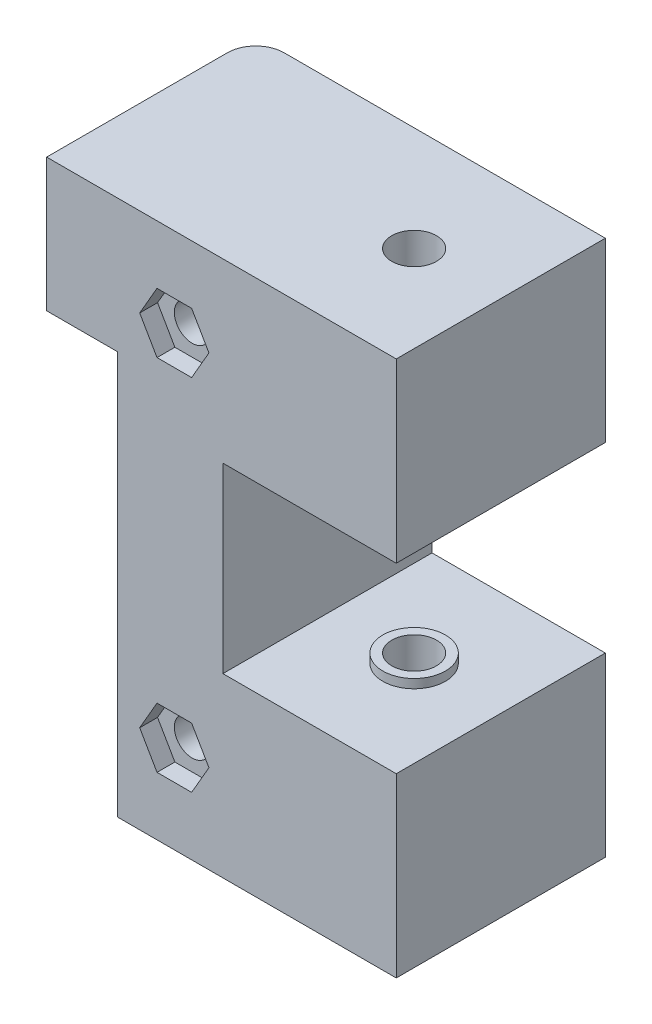
from build123d import *

# Parameters (mm, degrees)
MAINBLOCK_R                     = 2
MAINBLOCKBOSS_EXTRUDE1_DEPTH    = 23.4
TOPHOLECUT_SKETCH2_R            = 2.5
TOPHOLECUT_EXTRUDE1_DEPTH       = 45
MOUNTHOLEBORECUT_EXTRUDE2_DEPTH = 2
TOPSPACERSKETCH4_R              = 3.5
TOPSPACERSKETCH4_R_2            = 2.5
TOPSPACERBOSS_EXTRUDE2_DEPTH    = 1
LOWERSPACERBOSS_EXTRUDE3_START  = 1
LOWERSPACERSKETCH5_R            = 3.5
LOWERSPACERSKETCH5_R_2          = 2.5
LOWERSPACERBOSS_EXTRUDE3_DEPTH  = 1
PUSHPINHOLESKETCH1_R            = 1
PUSHPINHOLECUT_EXTRUDE1_DEPTH   = 76.354665582
MIDRAILINDENTSKETCH1_W          = 7.9375
MIDRAILINDENTSKETCH1_H          = 45.1
MIDRAILINDENTCUT_EXTRUDE1_DEPTH = 76.354665582
VERTICALSUPPORTFILLET1_R        = 3.175


with BuildPart() as part:
    # MainBlock → MainBlockBoss-Extrude1 (new body)
    with BuildSketch(Plane.XY):
        Polygon((0, 0), (39.125, 0), (39.125, 19.8), (19.725, 19.8), (19.725, 40.2), (39.125, 40.2), (39.125, 60), (0, 60), align=None)
        with Locations((14.2875, 50.1)):
            Circle(MAINBLOCK_R, mode=Mode.SUBTRACT)
        with Locations((14.2875, 9.9)):
            Circle(MAINBLOCK_R, mode=Mode.SUBTRACT)
    extrude(amount=MAINBLOCKBOSS_EXTRUDE1_DEPTH)

    # TopHoleCut-Sketch2 → TopHoleCut-Extrude1 (cut)
    with BuildSketch(Plane(origin=(0, 60, 0), x_dir=(1, 0, 0), z_dir=(0, 1, 0))):
        with Locations((29.425, -11.7)):
            Circle(TOPHOLECUT_SKETCH2_R)
    extrude(amount=-TOPHOLECUT_EXTRUDE1_DEPTH, mode=Mode.SUBTRACT)

    # MountHoleBoreSketch3 → MountHoleBoreCut-Extrude2 (cut)
    with BuildSketch(Plane.XY.offset(23.4)):
        Polygon((18.1625, 50.1), (16.225, 53.45584844), (12.35, 53.45584844), (10.4125, 50.1), (12.35, 46.74415156), (16.225, 46.74415156), align=None)
        Polygon((18.1625, 9.9), (16.225, 13.25584844), (12.35, 13.25584844), (10.4125, 9.9), (12.35, 6.54415156), (16.225, 6.54415156), align=None)
    extrude(amount=-MOUNTHOLEBORECUT_EXTRUDE2_DEPTH, mode=Mode.SUBTRACT)

    # TopSpacerSketch4 → TopSpacerBoss-Extrude2 (add)
    with BuildSketch(Plane.XZ.offset(-40.2)):
        with Locations((29.425, 11.7)):
            Circle(TOPSPACERSKETCH4_R)
        with Locations((29.425, 11.7)):
            Circle(TOPSPACERSKETCH4_R_2, mode=Mode.SUBTRACT)
    extrude(amount=TOPSPACERBOSS_EXTRUDE2_DEPTH)

    # LowerSpacerSketch5 → LowerSpacerBoss-Extrude3 (add)
    with BuildSketch(Plane(origin=(0, 19.8, 0), x_dir=(1, 0, 0), z_dir=(0, 1, 0)).offset(LOWERSPACERBOSS_EXTRUDE3_START)):
        with Locations((29.425, -11.7)):
            Circle(LOWERSPACERSKETCH5_R)
        with Locations((29.425, -11.7)):
            Circle(LOWERSPACERSKETCH5_R_2, mode=Mode.SUBTRACT)
    extrude(amount=-LOWERSPACERBOSS_EXTRUDE3_DEPTH)

    # PushPinHoleSketch1 → PushPinHoleCut-Extrude1 (cut, through all)
    with BuildSketch(Plane.XZ):
        with Locations((29.425, 11.7)):
            Circle(PUSHPINHOLESKETCH1_R)
    extrude(amount=-PUSHPINHOLECUT_EXTRUDE1_DEPTH, mode=Mode.SUBTRACT)

    # MidRailIndentSketch1 → MidRailIndentCut-Extrude1 (cut, through all)
    with BuildSketch(Plane.XY.offset(23.4)):
        with Locations((3.96875, 22.55)):
            Rectangle(MIDRAILINDENTSKETCH1_W, MIDRAILINDENTSKETCH1_H)
    extrude(amount=-MIDRAILINDENTCUT_EXTRUDE1_DEPTH, mode=Mode.SUBTRACT)

    # VerticalSupportFillet1
    verticalsupportfillet1_edges = [part.edges().sort_by_distance(p)[0] for p in [
        (0, 52.55, 0),
    ]]
    fillet(verticalsupportfillet1_edges, radius=VERTICALSUPPORTFILLET1_R)


solid = part.part
